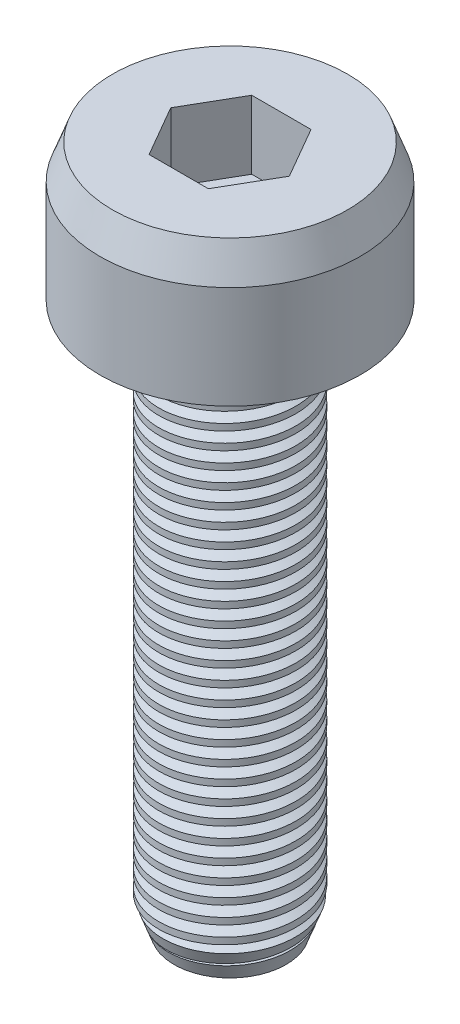
from build123d import *

# Parameters (mm, degrees)
SKETCH3_R           = 1.9
BOSS_EXTRUDE3_DEPTH = 1.5
SKETCH4_R           = 1.9
BOSS_EXTRUDE5_DEPTH = 0.5
BOSS_EXTRUDE5_TAPER = 20
CUT_EXTRUDE1_DEPTH  = 1
SKETCH7_R           = 1
BOSS_EXTRUDE8_DEPTH = 7.5
SKETCH11_R          = 1
BOSS_EXTRUDE9_DEPTH = 0.5
BOSS_EXTRUDE9_TAPER = 20
CUT_SWEEP2_PITCH    = 0.25
CUT_SWEEP2_TO       = 8


with BuildPart() as part:
    # Sketch3 → Boss-Extrude3 (new body)
    with BuildSketch(Plane(origin=(0, 0, 0), x_dir=(1, 0, 0), z_dir=(0, 1, 0))):
        with Locations(Location((0, 0, 0), (0, 0, 270))):
            Circle(SKETCH3_R)
    extrude(amount=BOSS_EXTRUDE3_DEPTH)

    # Sketch4 → Boss-Extrude5 (add)
    with BuildSketch(Plane(origin=(0, 1.5, 0), x_dir=(1, 0, 0), z_dir=(0, 1, 0))):
        with Locations(Location((0, 0, 0), (0, 0, 270))):
            Circle(SKETCH4_R)
    extrude(amount=BOSS_EXTRUDE5_DEPTH, taper=BOSS_EXTRUDE5_TAPER)

    # Sketch6 → Cut-Extrude1 (cut)
    with BuildSketch(Plane(origin=(0, 2, 0), x_dir=(1, 0, 0), z_dir=(0, 1, 0))):
        Polygon((0.866025404, 0), (0.433012702, 0.75), (-0.433012702, 0.75), (-0.866025404, 0), (-0.433012702, -0.75), (0.433012702, -0.75), align=None)
    extrude(amount=-CUT_EXTRUDE1_DEPTH, mode=Mode.SUBTRACT)

    # Sketch7 → Boss-Extrude8 (add)
    with BuildSketch(Plane.XZ):
        with Locations(Location((0, 0, 0), (0, 0, 90))):
            Circle(SKETCH7_R)
    extrude(amount=BOSS_EXTRUDE8_DEPTH)

    # Sketch11 → Boss-Extrude9 (add)
    with BuildSketch(Plane.XZ.offset(7.5)):
        with Locations(Location((0, 0, 0), (0, 0, 90))):
            Circle(SKETCH11_R)
    extrude(amount=BOSS_EXTRUDE9_DEPTH, taper=BOSS_EXTRUDE9_TAPER)

    # Cut-Sweep2: arcs per turn and ends read off the stored shape
    # Cut-Sweep2: the profile of Sketch13 screwed along a right-hand helix through 32.666667 turns, 6 arcs to a turn; built about Z, then put on its axis
    cut_sweep2_z = Axis((0, 0, 0), (0, 0, 1))
    cut_sweep2_corners = [(0.866719286, 0, 0.004424812), (1.057244874, 0, -0.105575188), (1.057244874, 0, 0.114424812)]
    with BuildLine(mode=Mode.PRIVATE) as cut_sweep2_profile:
        Line(cut_sweep2_corners[0], cut_sweep2_corners[1])
        Line(cut_sweep2_corners[1], cut_sweep2_corners[2])
        Line(cut_sweep2_corners[2], cut_sweep2_corners[0])
    cut_sweep2_cap = Face(cut_sweep2_profile.wire())
    cut_sweep2_turn_angles = [0, 30, 60, 90, 120, 150, 180, 210, 240, 270, 300, 330, 360]
    cut_sweep2_turn_weights = [1, 0.8660254037844387, 1, 0.8660254037844387, 1, 0.8660254037844387, 1, 0.8660254037844387, 1, 0.8660254037844387, 1, 0.8660254037844387, 1]
    cut_sweep2_turn_rails = [Edge.make_bspline([Vector(p[0], p[1], 0).rotate(cut_sweep2_z, cut_sweep2_turn_angles[k]) / cut_sweep2_turn_weights[k] + Vector(0, 0, p[2] + CUT_SWEEP2_PITCH * cut_sweep2_turn_angles[k] / 360) for k in range(13)], [0, 0, 0, 1, 1, 2, 2, 3, 3, 4, 4, 5, 5, 6, 6, 6], 2, cut_sweep2_turn_weights) for p in cut_sweep2_corners]
    cut_sweep2_turn_sides = [Face.make_surface_from_curves(cut_sweep2_turn_rails[p[0]], cut_sweep2_turn_rails[p[1]]) for p in [(0, 1), (1, 2), (2, 0)]]
    cut_sweep2_last_angles = [11520, 11550, 11580, 11610, 11640, 11670, 11700, 11730, 11760]
    cut_sweep2_last_weights = [1, 0.8660254037844387, 1, 0.8660254037844387, 1, 0.8660254037844387, 1, 0.8660254037844387, 1]
    cut_sweep2_last_rails = [Edge.make_bspline([Vector(p[0], p[1], 0).rotate(cut_sweep2_z, cut_sweep2_last_angles[k]) / cut_sweep2_last_weights[k] + Vector(0, 0, p[2] + CUT_SWEEP2_PITCH * cut_sweep2_last_angles[k] / 360) for k in range(9)], [0, 0, 0, 1, 1, 2, 2, 3, 3, 4, 4, 4], 2, cut_sweep2_last_weights) for p in cut_sweep2_corners]
    cut_sweep2_last_sides = [Face.make_surface_from_curves(cut_sweep2_last_rails[p[0]], cut_sweep2_last_rails[p[1]]) for p in [(0, 1), (1, 2), (2, 0)]]
    cut_sweep2 = Plane(origin=(0, -8, 0), x_dir=(1, 0, 0), z_dir=(0, 1, 0)) * split(Solid(Shell([*[p.moved(Location((0, 0, CUT_SWEEP2_PITCH * i))) for i in range(32) for p in cut_sweep2_turn_sides], *cut_sweep2_last_sides, cut_sweep2_cap, cut_sweep2_cap.rotate(cut_sweep2_z, 11760).moved(Location((0, 0, CUT_SWEEP2_PITCH * 11760 / 360)))])), bisect_by=Plane.XY.offset(CUT_SWEEP2_TO), keep=Keep.BOTTOM, mode=Mode.PRIVATE)
    add(cut_sweep2, mode=Mode.SUBTRACT)


solid = part.part
